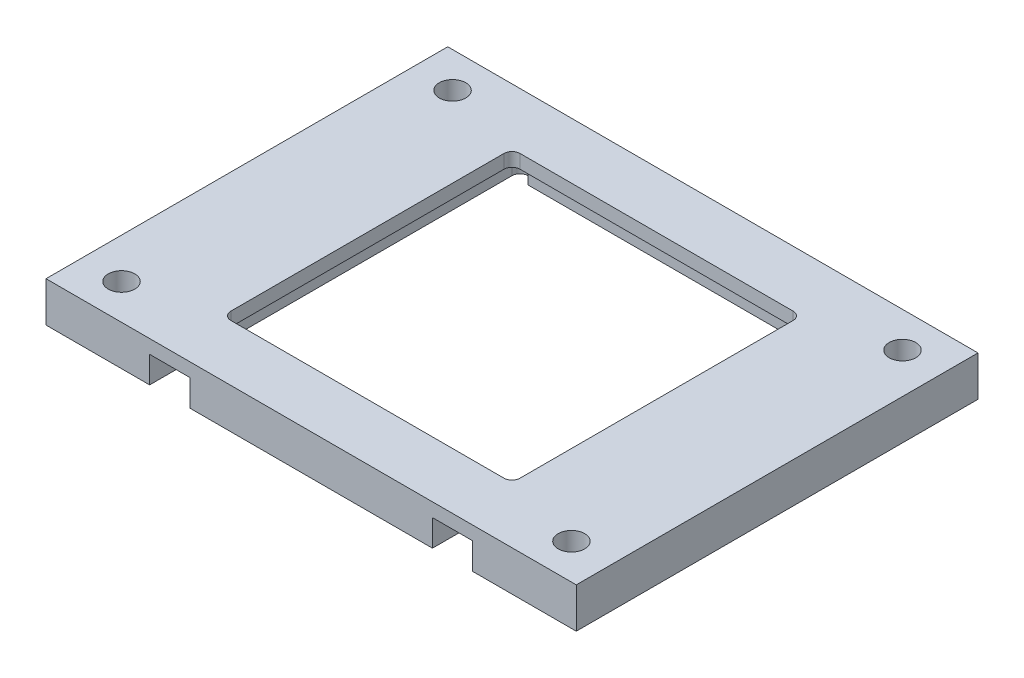
from build123d import *

# Parameters (mm, degrees)
SKETCH1_W           = 66
SKETCH1_H           = 50
SKETCH1_R           = 1.65
BOSS_EXTRUDE1_DEPTH = 5
SKETCH2_W           = 36
SKETCH2_H           = 36
BOSS_EXTRUDE2_DEPTH = 1.7
CUT_EXTRUDE1_REACH  = 62.117
SKETCH3_W           = 5
SKETCH3_H           = 3.3
FILLET1_R           = 1


with BuildPart() as part:
    # Sketch1 → Boss-Extrude1 (new body)
    with BuildSketch(Plane(origin=(0, 0, 0), x_dir=(1, 0, 0), z_dir=(0, 1, 0))):
        Rectangle(SKETCH1_W, SKETCH1_H)
        with Locations(Location((-28, 20.6, 0), (0, 0, 270))):
            Circle(SKETCH1_R, mode=Mode.SUBTRACT)
        with Locations(Location((28, 20.6, 0), (0, 0, 270))):
            Circle(SKETCH1_R, mode=Mode.SUBTRACT)
        with Locations(Location((-28, -20.6, 0), (0, 0, 270))):
            Circle(SKETCH1_R, mode=Mode.SUBTRACT)
        with Locations(Location((28, -20.6, 0), (0, 0, 270))):
            Circle(SKETCH1_R, mode=Mode.SUBTRACT)
        Polygon((20.1, -20.1), (20.1, 21.1), (18.1, 21.1), (18.1, 20.1), (-18.1, 20.1), (-18.1, 21.1), (-20.1, 21.1), (-20.1, -20.1), align=None, mode=Mode.SUBTRACT)
    extrude(amount=BOSS_EXTRUDE1_DEPTH)

    # Sketch2 → Boss-Extrude2 (add)
    with BuildSketch(Plane(origin=(0, 5, 0), x_dir=(1, 0, 0), z_dir=(0, 1, 0))):
        Polygon((-20.1, 21.1), (-20.1, -20.1), (20.1, -20.1), (20.1, 21.1), (18.1, 21.1), (18.1, 20.1), (-18.1, 20.1), (-18.1, 21.1), align=None)
        Rectangle(SKETCH2_W, SKETCH2_H, mode=Mode.SUBTRACT)
    extrude(amount=-BOSS_EXTRUDE2_DEPTH)

    # Sketch3 → Cut-Extrude1 (cut, up to next)
    with BuildSketch(Plane.XY.offset(25), mode=Mode.PRIVATE) as cut_extrude1_sk1:
        with Locations((-17.6, 1.65)):
            Rectangle(SKETCH3_W, SKETCH3_H)
    cut_extrude1_tool1 = extrude(cut_extrude1_sk1.sketch, amount=-CUT_EXTRUDE1_REACH, mode=Mode.PRIVATE) & part.part
    # Sketch3 → Cut-Extrude1 (cut, up to next)
    with BuildSketch(Plane.XY.offset(25), mode=Mode.PRIVATE) as cut_extrude1_sk2:
        with Locations((17.6, 1.65)):
            Rectangle(SKETCH3_W, SKETCH3_H)
    cut_extrude1_tool2 = extrude(cut_extrude1_sk2.sketch, amount=-CUT_EXTRUDE1_REACH, mode=Mode.PRIVATE) & part.part
    add(cut_extrude1_tool1.solids().sort_by_distance((-17.6, 1.65, 25))[0], mode=Mode.SUBTRACT)
    add(cut_extrude1_tool2.solids().sort_by_distance((17.6, 1.65, 25))[0], mode=Mode.SUBTRACT)

    # Fillet1
    fillet1_edges = [part.edges().sort_by_distance(p)[0] for p in [
        (-18, 4.15, 18),
        (18, 4.15, 18),
        (18, 4.15, -18),
        (-18, 4.15, -18),
        (-20.1, 1.65, -21.1),
        (-18.1, 1.65, -21.1),
        (18.1, 1.65, -21.1),
        (20.1, 1.65, -21.1),
    ]]
    fillet(fillet1_edges, radius=FILLET1_R - 0.0001)  # a hair under: the kernel refuses the full size


solid = part.part
